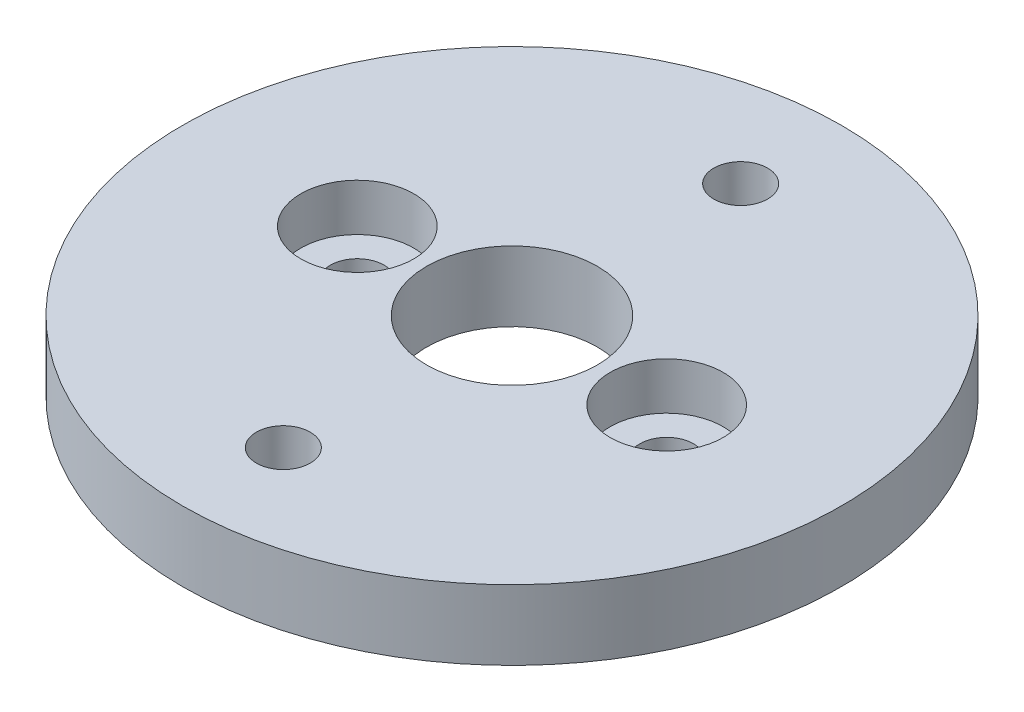
from build123d import *

# Parameters (mm, degrees)
SKETCH1_R           = 12.25
BOSS_EXTRUDE1_DEPTH = 2.6
CUT_EXTRUDE1_REACH  = 19.518
SKETCH2_R           = 3.175
SKETCH2_R_2         = 1
SKETCH3_R           = 2.1
CUT_EXTRUDE2_DEPTH  = 1.75


with BuildPart() as part:
    # Sketch1 → Boss-Extrude1 (new body)
    with BuildSketch(Plane(origin=(0, 0, 0), x_dir=(1, 0, 0), z_dir=(0, 1, 0))):
        Circle(SKETCH1_R)
    extrude(amount=BOSS_EXTRUDE1_DEPTH)

    # Sketch2 → Cut-Extrude1 (cut, up to next)
    with BuildSketch(Plane.XZ, mode=Mode.PRIVATE) as cut_extrude1_sk1:
        Circle(SKETCH2_R)
    cut_extrude1_tool1 = extrude(cut_extrude1_sk1.sketch, amount=-CUT_EXTRUDE1_REACH, mode=Mode.PRIVATE) & part.part
    # Sketch2 → Cut-Extrude1 (cut, up to next)
    with BuildSketch(Plane.XZ, mode=Mode.PRIVATE) as cut_extrude1_sk2:
        with Locations((0, 8.5)):
            Circle(SKETCH2_R_2)
    cut_extrude1_tool2 = extrude(cut_extrude1_sk2.sketch, amount=-CUT_EXTRUDE1_REACH, mode=Mode.PRIVATE) & part.part
    # Sketch2 → Cut-Extrude1 (cut, up to next)
    with BuildSketch(Plane.XZ, mode=Mode.PRIVATE) as cut_extrude1_sk3:
        with Locations((0, -8.5)):
            Circle(SKETCH2_R_2)
    cut_extrude1_tool3 = extrude(cut_extrude1_sk3.sketch, amount=-CUT_EXTRUDE1_REACH, mode=Mode.PRIVATE) & part.part
    # Sketch2 → Cut-Extrude1 (cut, up to next)
    with BuildSketch(Plane.XZ, mode=Mode.PRIVATE) as cut_extrude1_sk4:
        with Locations((-5.75, 0)):
            Circle(SKETCH2_R_2)
    cut_extrude1_tool4 = extrude(cut_extrude1_sk4.sketch, amount=-CUT_EXTRUDE1_REACH, mode=Mode.PRIVATE) & part.part
    # Sketch2 → Cut-Extrude1 (cut, up to next)
    with BuildSketch(Plane.XZ, mode=Mode.PRIVATE) as cut_extrude1_sk5:
        with Locations((5.75, 0)):
            Circle(SKETCH2_R_2)
    cut_extrude1_tool5 = extrude(cut_extrude1_sk5.sketch, amount=-CUT_EXTRUDE1_REACH, mode=Mode.PRIVATE) & part.part
    add(cut_extrude1_tool1.solids().sort_by_distance((0, 0, 0))[0], mode=Mode.SUBTRACT)
    add(cut_extrude1_tool2.solids().sort_by_distance((0, 0, 8.5))[0], mode=Mode.SUBTRACT)
    add(cut_extrude1_tool3.solids().sort_by_distance((0, 0, -8.5))[0], mode=Mode.SUBTRACT)
    add(cut_extrude1_tool4.solids().sort_by_distance((-5.75, 0, 0))[0], mode=Mode.SUBTRACT)
    add(cut_extrude1_tool5.solids().sort_by_distance((5.75, 0, 0))[0], mode=Mode.SUBTRACT)

    # Sketch3 → Cut-Extrude2 (cut)
    with BuildSketch(Plane(origin=(0, 2.6, 0), x_dir=(1, 0, 0), z_dir=(0, 1, 0))):
        with Locations((-5.75, 0)):
            Circle(SKETCH3_R)
        with Locations((5.75, 0)):
            Circle(SKETCH3_R)
    extrude(amount=-CUT_EXTRUDE2_DEPTH, mode=Mode.SUBTRACT)


solid = part.part
